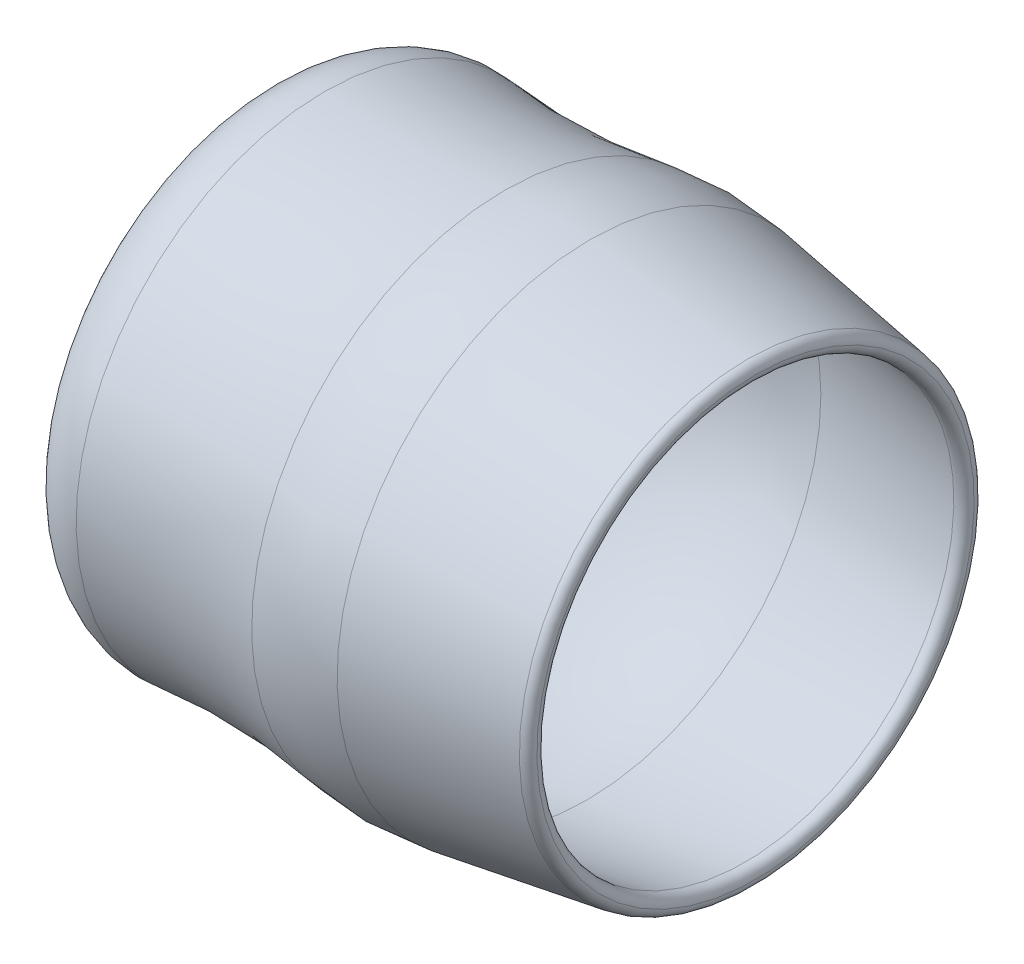
from build123d import *

# Parameters (mm, degrees)
FILLET1_R = 0.5


with BuildPart() as part:
    # Sketch2 → Revolve1 (revolve)
    with BuildSketch(Plane.XY):
        with BuildLine():
            Line((-86.101123841, -5.64973336), (-88.101123841, -5.64973336))
            Line((-88.101123841, -5.64973336), (-89.278275677, -5.64973336))
            ThreePointArc((-89.278275677, -5.64973336), (-89.10084359, -0.391604097), (-88.569354565, 4.842603093))
            ThreePointArc((-88.569354565, 4.842603093), (-87.443565623, 6.803114863), (-85.26891575, 7.421099549))
            ThreePointArc((-85.26891575, 7.421099549), (-80.518231075, 7.223948348), (-75.784663044, 7.672509564))
            ThreePointArc((-75.784663044, 7.672509564), (-73.546078322, 7.850154417), (-71.309016698, 7.654260207))
            ThreePointArc((-71.309016698, 7.654260207), (-66.960113272, 6.937963646), (-62.601123841, 6.28584947))
            Line((-62.601123841, 6.28584947), (-62.601123841, 5.275841234))
            ThreePointArc((-62.601123841, 5.275841234), (-67.04517898, 5.939067763), (-71.478802412, 6.668779202))
            ThreePointArc((-71.478802412, 6.668779202), (-81.654724965, 3.910052669), (-86.101123841, -5.64973336))
        make_face()
    revolve(axis=Axis((86.398876159, -5.64973336, 0), (-1, 0, 0)))

    # Fillet1
    # the kernel refuses this fillet: 0.5 mm, written as the material it takes off along each edge
    with BuildSketch(Plane(origin=(-62.601123841, -5.64973336, 0), x_dir=(0, 1, 0), z_dir=(0, 0, 1))) as fillet1_piece_1:
        with BuildLine():
            CenterArc((11.501916817, 0.5), FILLET1_R, 270, 81.83079423)
            ThreePointArc((11.99684319, 0.428951526), (11.966135307, 0.21448686), (11.93558283, 0))
            Line((11.93558283, 0), (11.501916817, 0))
        make_face()
    revolve(axis=Axis((-62.601123841, -5.64973336, 0), (-1, 0, 0)), mode=Mode.SUBTRACT)
    with BuildSketch(Plane(origin=(-62.601123841, -5.64973336, 0), x_dir=(0, 1, 0), z_dir=(0, 0, 1))) as fillet1_piece_2:
        with BuildLine():
            CenterArc((11.501916817, 0.5), FILLET1_R, 171.83079423, 98.16920577)
            ThreePointArc((11.006990445, 0.571048474), (10.966145272, 0.285543805), (10.925574594, 0))
            Line((10.925574594, 0), (11.501916817, 0))
        make_face()
    revolve(axis=Axis((-62.601123841, -5.64973336, 0), (-1, 0, 0)), mode=Mode.SUBTRACT)


solid = part.part
